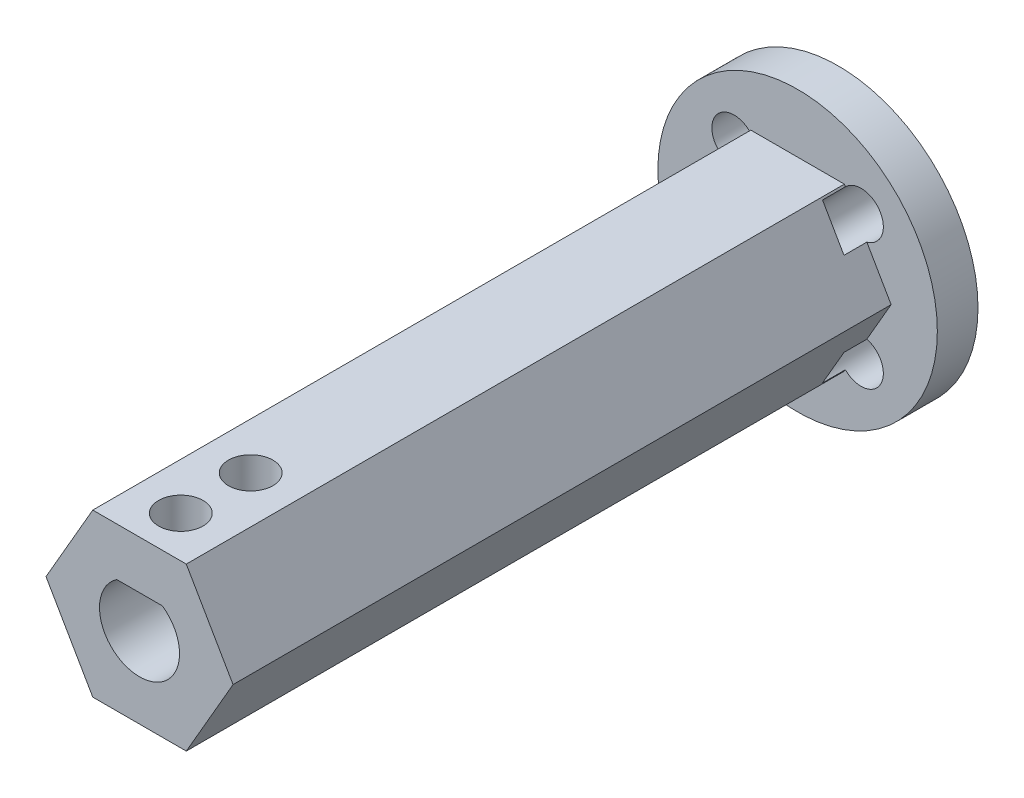
from build123d import *

# Parameters (mm, degrees)
SALIENTE_EXTRUIR1_DEPTH    = 55
CROQUIS2_R                 = 1.75
CORTAR_EXTRUIR1_DEPTH      = 7.5
CROQUIS3_R                 = 11
SALIENTE_EXTRUIR2_DEPTH    = 3.2
CORTAR_EXTRUIR2_DEPTH      = 58.15767665
CORTAR_EXTRUIR2_DEPTH_BACK = 5
CROQUIS5_R                 = 1.75


with BuildPart() as part:
    # Croquis1 → Saliente-Extruir1 (new body)
    with BuildSketch(Plane.XY):
        Polygon((7.361677812, 0), (3.680838906, 6.3754), (-3.680838906, 6.3754), (-7.361677812, 0), (-3.680838906, -6.3754), (3.680838906, -6.3754), align=None)
        with BuildLine():
            Line((-1.8, 2.585053191), (1.8, 2.585053191))
            ThreePointArc((1.8, 2.585053191), (0, -3.15), (-1.8, 2.585053191))
        make_face(mode=Mode.SUBTRACT)
    extrude(amount=SALIENTE_EXTRUIR1_DEPTH)

    # Croquis2 → Cortar-Extruir1 (cut)
    with BuildSketch(Plane(origin=(0, 6.3754, 0), x_dir=(1, 0, 0), z_dir=(0, 1, 0))):
        with Locations((0, -51.75)):
            Circle(CROQUIS2_R)
        with Locations((0, -46.25)):
            Circle(CROQUIS2_R)
    extrude(amount=-CORTAR_EXTRUIR1_DEPTH, mode=Mode.SUBTRACT)

    # Croquis3 → Saliente-Extruir2 (add)
    with BuildSketch(Plane(origin=(0, 0, 0), x_dir=(-1, 0, 0), z_dir=(0, 0, -1))):
        Circle(CROQUIS3_R)
    extrude(amount=-SALIENTE_EXTRUIR2_DEPTH)

    # Croquis5 → Cortar-Extruir2 (cut, two sides: drawn at the far end of the back side and taken through both)
    with BuildSketch(Plane(origin=(0, 0, 0), x_dir=(-1, 0, 0), z_dir=(0, 0, -1)).offset(-CORTAR_EXTRUIR2_DEPTH_BACK)):
        with Locations((-5, 5)):
            Circle(CROQUIS5_R)
        with Locations((5, 5)):
            Circle(CROQUIS5_R)
        with Locations((5, -5)):
            Circle(CROQUIS5_R)
        with Locations((-5, -5)):
            Circle(CROQUIS5_R)
    extrude(amount=CORTAR_EXTRUIR2_DEPTH + CORTAR_EXTRUIR2_DEPTH_BACK, mode=Mode.SUBTRACT)


solid = part.part
